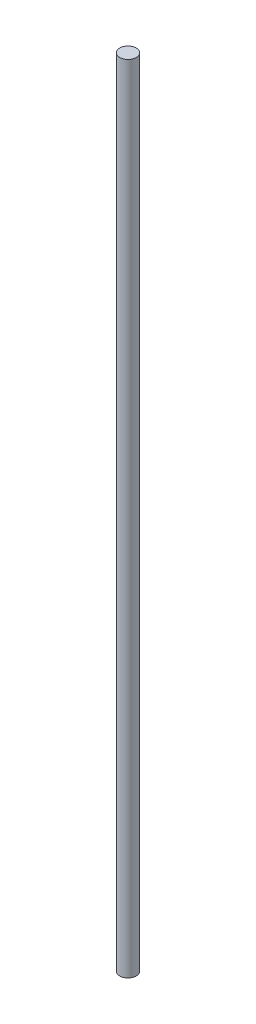
from build123d import *

# Parameters (mm, degrees)
SKETCH1_R           = 4
BOSS_EXTRUDE1_DEPTH = 385.75


with BuildPart() as part:
    # Sketch1 → Boss-Extrude1 (new body)
    with BuildSketch(Plane(origin=(0, 0, 0), x_dir=(1, 0, 0), z_dir=(0, 1, 0))):
        Circle(SKETCH1_R)
    extrude(amount=BOSS_EXTRUDE1_DEPTH)


solid = part.part
